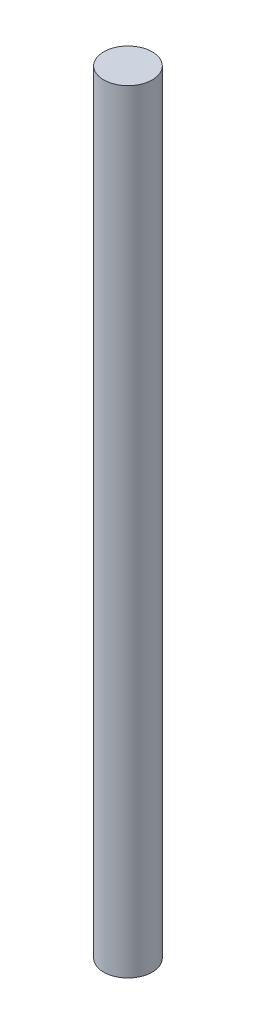
from build123d import *

# Parameters (mm, degrees)
SKETCH_1_R      = 1
EXTRUDE_1_DEPTH = 15.9


with BuildPart() as part:
    # 草图1 → 凸台-拉伸1 (new, symmetric)
    with BuildSketch(Plane(origin=(0, 0, 0), x_dir=(1, 0, 0), z_dir=(0, 1, 0))):
        Circle(SKETCH_1_R)
    extrude(amount=EXTRUDE_1_DEPTH, both=True)


solid = part.part
